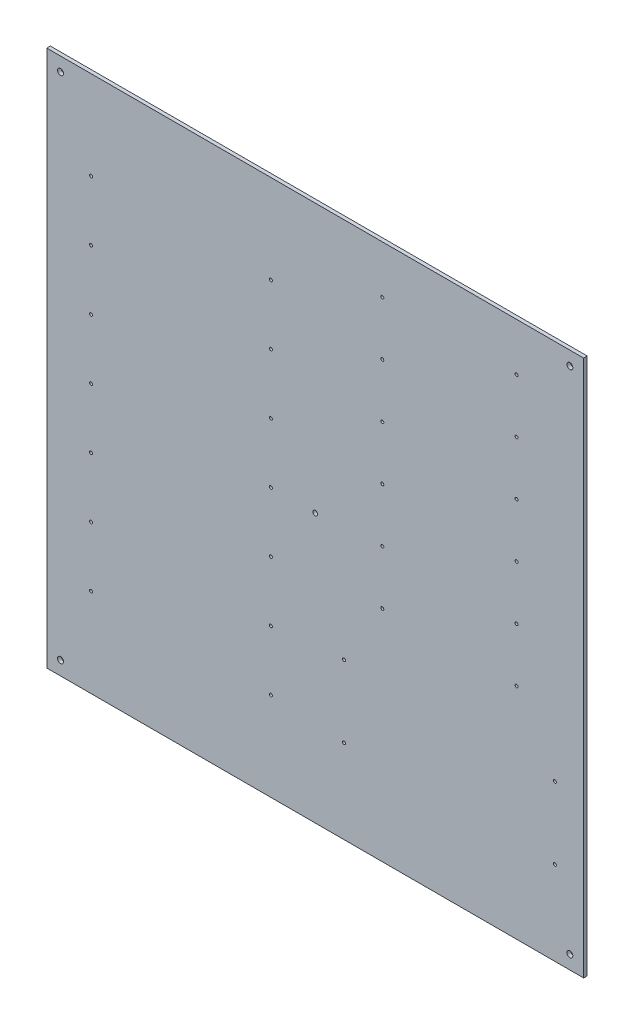
from build123d import *

# Parameters (mm, degrees)
SCHIZZO1_W                   = 448
SCHIZZO1_H                   = 448
SCHIZZO1_R                   = 2.5
SCHIZZO1_R_2                 = 1.25
SCHIZZO1_R_3                 = 2
ESTRUSIONE_ESTRUSIONE1_DEPTH = 3


with BuildPart() as part:
    # Schizzo1 → Estrusione-Estrusione1 (new body)
    with BuildSketch(Plane.XY):
        with Locations((224, 224)):
            Rectangle(SCHIZZO1_W, SCHIZZO1_H)
        with Locations((11.5, 436.5)):
            Circle(SCHIZZO1_R, mode=Mode.SUBTRACT)
        with Locations((436.5, 436.5)):
            Circle(SCHIZZO1_R, mode=Mode.SUBTRACT)
        with Locations((11.5, 11.5)):
            Circle(SCHIZZO1_R, mode=Mode.SUBTRACT)
        with Locations((436.5, 11.5)):
            Circle(SCHIZZO1_R, mode=Mode.SUBTRACT)
        with Locations((280, 183)):
            Circle(SCHIZZO1_R_2, mode=Mode.SUBTRACT)
        with Locations((392, 183)):
            Circle(SCHIZZO1_R_2, mode=Mode.SUBTRACT)
        with Locations((36.958788995, 224)):
            Circle(SCHIZZO1_R_2, mode=Mode.SUBTRACT)
        with Locations((36.958788995, 274)):
            Circle(SCHIZZO1_R_2, mode=Mode.SUBTRACT)
        with Locations((187.041211005, 274)):
            Circle(SCHIZZO1_R_2, mode=Mode.SUBTRACT)
        with Locations((36.958788995, 324)):
            Circle(SCHIZZO1_R_2, mode=Mode.SUBTRACT)
        with Locations((187.041211005, 324)):
            Circle(SCHIZZO1_R_2, mode=Mode.SUBTRACT)
        with Locations((36.958788995, 374)):
            Circle(SCHIZZO1_R_2, mode=Mode.SUBTRACT)
        with Locations((187.041211005, 374)):
            Circle(SCHIZZO1_R_2, mode=Mode.SUBTRACT)
        with Locations((36.958788995, 174)):
            Circle(SCHIZZO1_R_2, mode=Mode.SUBTRACT)
        with Locations((248, 70)):
            Circle(SCHIZZO1_R_2, mode=Mode.SUBTRACT)
        with Locations((248, 130)):
            Circle(SCHIZZO1_R_2, mode=Mode.SUBTRACT)
        with Locations((424, 130)):
            Circle(SCHIZZO1_R_2, mode=Mode.SUBTRACT)
        with Locations((424, 70)):
            Circle(SCHIZZO1_R_2, mode=Mode.SUBTRACT)
        with Locations((187.041211005, 174)):
            Circle(SCHIZZO1_R_2, mode=Mode.SUBTRACT)
        with Locations((280, 408)):
            Circle(SCHIZZO1_R_2, mode=Mode.SUBTRACT)
        with Locations((392, 408)):
            Circle(SCHIZZO1_R_2, mode=Mode.SUBTRACT)
        with Locations((36.958788995, 124)):
            Circle(SCHIZZO1_R_2, mode=Mode.SUBTRACT)
        with Locations((187.041211005, 124)):
            Circle(SCHIZZO1_R_2, mode=Mode.SUBTRACT)
        with Locations((280, 363)):
            Circle(SCHIZZO1_R_2, mode=Mode.SUBTRACT)
        with Locations((392, 363)):
            Circle(SCHIZZO1_R_2, mode=Mode.SUBTRACT)
        with Locations((36.958788995, 74)):
            Circle(SCHIZZO1_R_2, mode=Mode.SUBTRACT)
        with Locations((187.041211005, 74)):
            Circle(SCHIZZO1_R_2, mode=Mode.SUBTRACT)
        with Locations((280, 318)):
            Circle(SCHIZZO1_R_2, mode=Mode.SUBTRACT)
        with Locations((392, 318)):
            Circle(SCHIZZO1_R_2, mode=Mode.SUBTRACT)
        with Locations((280, 273)):
            Circle(SCHIZZO1_R_2, mode=Mode.SUBTRACT)
        with Locations((392, 273)):
            Circle(SCHIZZO1_R_2, mode=Mode.SUBTRACT)
        with Locations((280, 228)):
            Circle(SCHIZZO1_R_2, mode=Mode.SUBTRACT)
        with Locations((392, 228)):
            Circle(SCHIZZO1_R_2, mode=Mode.SUBTRACT)
        with Locations((187.041211005, 224)):
            Circle(SCHIZZO1_R_2, mode=Mode.SUBTRACT)
        with Locations((224, 224)):
            Circle(SCHIZZO1_R_3, mode=Mode.SUBTRACT)
    extrude(amount=-ESTRUSIONE_ESTRUSIONE1_DEPTH)


solid = part.part
